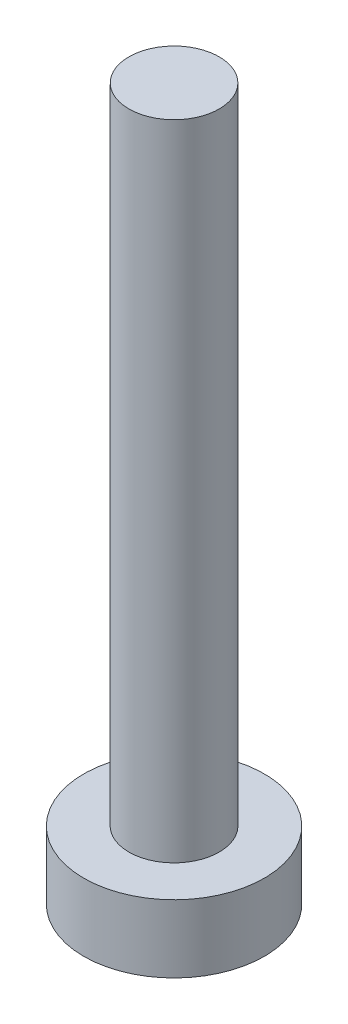
from build123d import *

# Parameters (mm, degrees)
ESQUISSE1_R        = 4
ESQUISSE1_R_2      = 2
BOSS_EXTRU_1_DEPTH = 3
ESQUISSE1_4_R      = 2
BOSS_EXTRU_3_DEPTH = 31.5


with BuildPart() as part:
    # Esquisse1 → Boss.-Extru.1 (new body)
    with BuildSketch(Plane(origin=(0, 0, 0), x_dir=(1, 0, 0), z_dir=(0, 1, 0))):
        Circle(ESQUISSE1_R)
        Circle(ESQUISSE1_R_2, mode=Mode.SUBTRACT)
    extrude(amount=BOSS_EXTRU_1_DEPTH)

    # Esquisse1<4> → Boss.-Extru.3 (add)
    with BuildSketch(Plane(origin=(0, 0, 0), x_dir=(1, 0, 0), z_dir=(0, 1, 0))):
        Circle(ESQUISSE1_4_R)
    extrude(amount=BOSS_EXTRU_3_DEPTH)


solid = part.part
